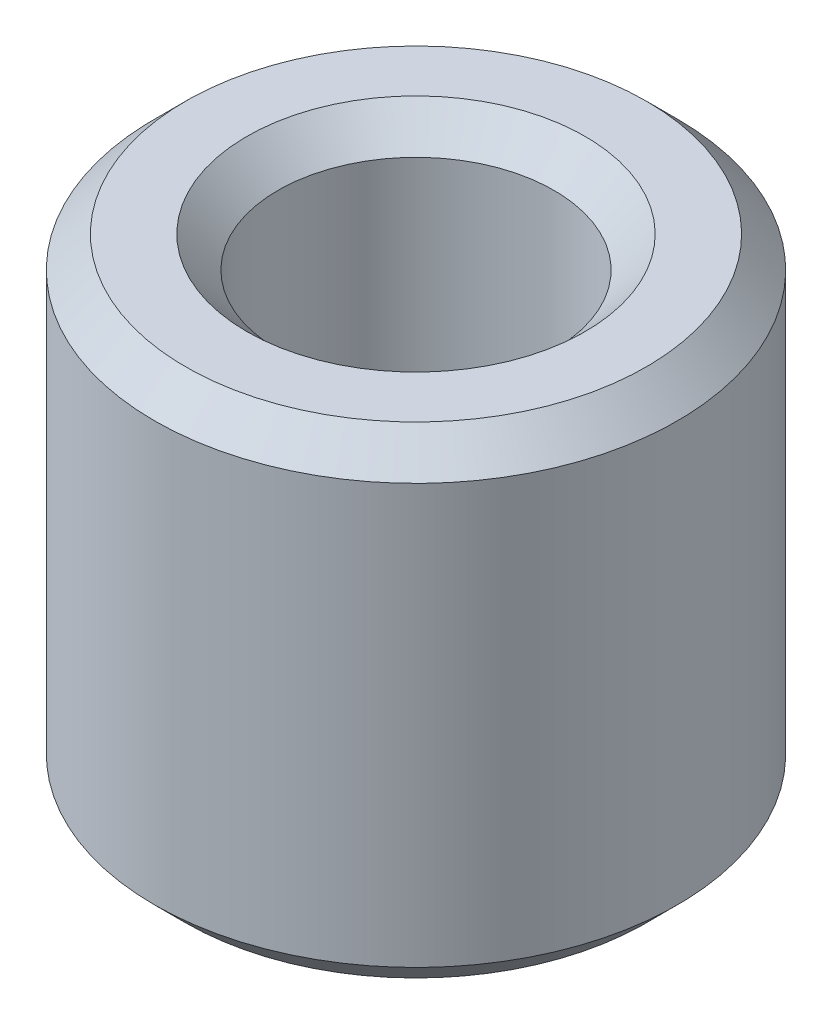
from build123d import *

# Parameters (mm, degrees)
SKETCH1_R           = 7.5
BOSS_EXTRUDE1_DEPTH = 13.814980232
SKETCH2_R           = 3.959191929
CUT_EXTRUDE1_DEPTH  = 18.417051381
CHAMFER1_SIZE       = 0.893719677


with BuildPart() as part:
    # Sketch1 → Boss-Extrude1 (new body)
    with BuildSketch(Plane(origin=(0, 0, 0), x_dir=(1, 0, 0), z_dir=(0, 1, 0))):
        Circle(SKETCH1_R)
    extrude(amount=BOSS_EXTRUDE1_DEPTH)

    # Sketch2 → Cut-Extrude1 (cut, through all)
    with BuildSketch(Plane(origin=(0, 0, 0), x_dir=(1, 0, 0), z_dir=(0, 1, 0))):
        Circle(SKETCH2_R)
    extrude(amount=CUT_EXTRUDE1_DEPTH, mode=Mode.SUBTRACT)

    # Chamfer1
    chamfer1_edges = [part.edges().sort_by_distance(p)[0] for p in [
        (-3.959191929, 13.814980232, 0),
        (-3.959191929, 0, 0),
        (-7.5, 0, 0),
        (-7.5, 13.814980232, 0),
    ]]
    chamfer(chamfer1_edges, length=CHAMFER1_SIZE)


solid = part.part
